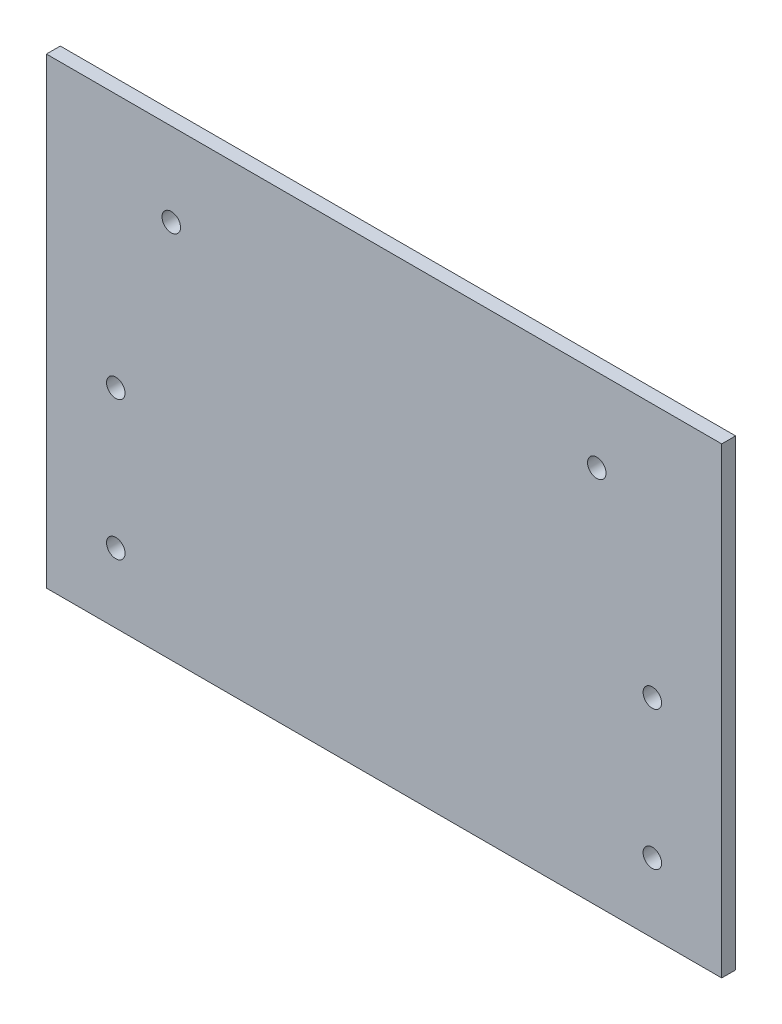
from build123d import *

# Parameters (mm, degrees)
SKETCH1_W           = 146
SKETCH1_H           = 100
BOSS_EXTRUDE1_DEPTH = 3
SKETCH2_R           = 2
CUT_EXTRUDE1_DEPTH  = 114.59106552
SKETCH3_R           = 2
CUT_EXTRUDE2_DEPTH  = 114.59106552
SKETCH4_R           = 2
CUT_EXTRUDE3_DEPTH  = 114.59106552


with BuildPart() as part:
    # Sketch1 → Boss-Extrude1 (new body)
    with BuildSketch(Plane.XY):
        with Locations((-1.123462833, 36.021174275)):
            Rectangle(SKETCH1_W, SKETCH1_H)
    extrude(amount=BOSS_EXTRUDE1_DEPTH)

    # Sketch2 → Cut-Extrude1 (cut, through all)
    with BuildSketch(Plane(origin=(0, 0, 0), x_dir=(-1, 0, 0), z_dir=(0, 0, -1))):
        with Locations((59.123462833, 1.021174275)):
            Circle(SKETCH2_R)
        with Locations((-56.876537167, 1.021174275)):
            Circle(SKETCH2_R)
    extrude(amount=-CUT_EXTRUDE1_DEPTH, mode=Mode.SUBTRACT)

    # Sketch3 → Cut-Extrude2 (cut, through all)
    with BuildSketch(Plane(origin=(0, 0, 0), x_dir=(-1, 0, 0), z_dir=(0, 0, -1))):
        with Locations((-56.876537167, 31.021174275)):
            Circle(SKETCH3_R)
        with Locations((59.123462833, 31.021174275)):
            Circle(SKETCH3_R)
    extrude(amount=-CUT_EXTRUDE2_DEPTH, mode=Mode.SUBTRACT)

    # Sketch4 → Cut-Extrude3 (cut, through all)
    with BuildSketch(Plane(origin=(0, 0, 0), x_dir=(-1, 0, 0), z_dir=(0, 0, -1))):
        with Locations((-44.866828557, 68.039856286)):
            Circle(SKETCH4_R)
        with Locations((47.124228631, 68.039856286)):
            Circle(SKETCH4_R)
    extrude(amount=-CUT_EXTRUDE3_DEPTH, mode=Mode.SUBTRACT)


solid = part.part
